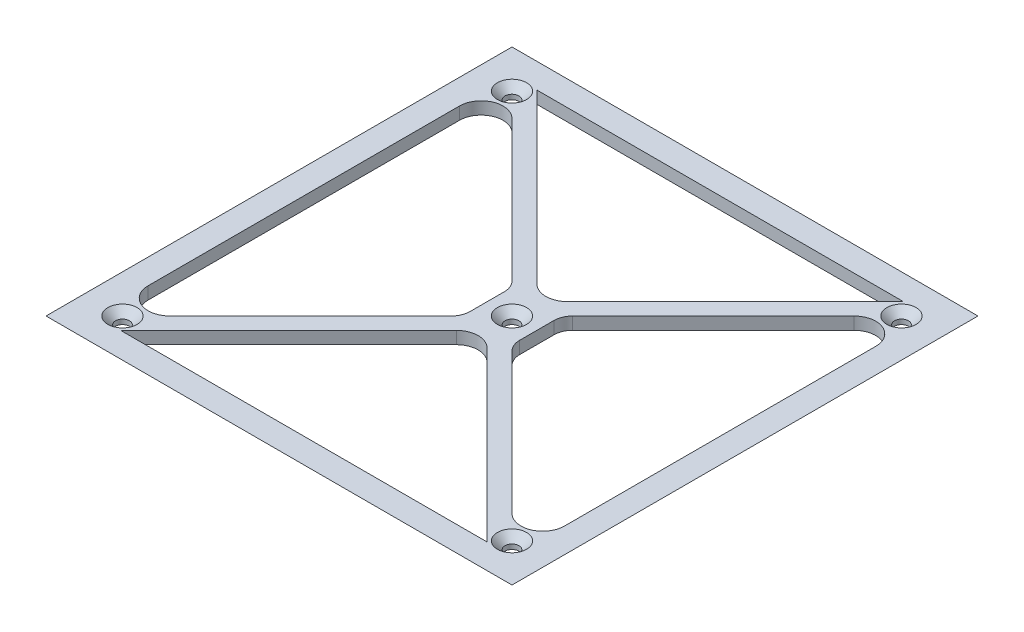
from build123d import *

# Parameters (mm, degrees)
SKETCH1_W                                      = 150
SKETCH1_H                                      = 150
BOSS_EXTRUDE2_DEPTH                            = 4
CSK_FOR_M4_FLAT_HEAD_MACHINE_SCREW1_AT_2_COUNT = 2
CSK_FOR_M4_FLAT_HEAD_MACHINE_SCREW1_AT_2_PITCH = 88.653975713
CSK_FOR_M4_FLAT_HEAD_MACHINE_SCREW1_AT_3_COUNT = 2
CSK_FOR_M4_FLAT_HEAD_MACHINE_SCREW1_AT_3_PITCH = 88.653975713
CSK_FOR_M4_FLAT_HEAD_MACHINE_SCREW1_AT_4_COUNT = 2
CSK_FOR_M4_FLAT_HEAD_MACHINE_SCREW1_AT_4_PITCH = 88.653975713
CSK_FOR_M4_FLAT_HEAD_MACHINE_SCREW1_AT_5_COUNT = 2
CSK_FOR_M4_FLAT_HEAD_MACHINE_SCREW1_AT_5_PITCH = 88.653975713
CHAMFER2_SIZE                                  = 4


with BuildPart() as part:
    # Sketch1 → Boss-Extrude2 (new body)
    with BuildSketch(Plane(origin=(0, 0, 0), x_dir=(1, 0, 0), z_dir=(0, 1, 0))):
        Rectangle(SKETCH1_W, SKETCH1_H)
        with BuildLine():
            Line((-59, 67), (59, 67))
            Line((59, 67), (4.949747468, 12.949747468))
            ThreePointArc((4.949747468, 12.949747468), (0, 10.899494937), (-4.949747468, 12.949747468))
            Line((-4.949747468, 12.949747468), (-59, 67))
        make_face(mode=Mode.SUBTRACT)
        with BuildLine():
            Line((59, -67), (-59, -67))
            Line((-59, -67), (-4.949747468, -12.949747468))
            ThreePointArc((-4.949747468, -12.949747468), (0, -10.899494937), (4.949747468, -12.949747468))
            Line((4.949747468, -12.949747468), (59, -67))
        make_face(mode=Mode.SUBTRACT)
        with BuildLine():
            Line((-67, -50.100505063), (-67, 50.100505063))
            ThreePointArc((-67, 50.100505063), (-62.678784027, 56.567661791), (-55.050252532, 55.050252532))
            Line((-55.050252532, 55.050252532), (-9.757359313, 9.757359313))
            ThreePointArc((-9.757359313, 9.757359313), (-8.456722805, 7.81081922), (-8, 5.514718626))
            Line((-8, 5.514718626), (-8, -5.514718626))
            ThreePointArc((-8, -5.514718626), (-8.456722805, -7.81081922), (-9.757359313, -9.757359313))
            Line((-9.757359313, -9.757359313), (-55.050252532, -55.050252532))
            ThreePointArc((-55.050252532, -55.050252532), (-62.678784027, -56.567661791), (-67, -50.100505063))
        make_face(mode=Mode.SUBTRACT)
        with BuildLine():
            ThreePointArc((67, -50.100505063), (62.678784027, -56.567661791), (55.050252532, -55.050252532))
            Line((55.050252532, -55.050252532), (9.757359313, -9.757359313))
            ThreePointArc((9.757359313, -9.757359313), (8.456722805, -7.81081922), (8, -5.514718626))
            Line((8, -5.514718626), (8, 5.514718626))
            ThreePointArc((8, 5.514718626), (8.456722805, 7.81081922), (9.757359313, 9.757359313))
            Line((9.757359313, 9.757359313), (55.050252532, 55.050252532))
            ThreePointArc((55.050252532, 55.050252532), (62.678784027, 56.567661791), (67, 50.100505063))
            Line((67, 50.100505063), (67, -50.100505063))
        make_face(mode=Mode.SUBTRACT)
    extrude(amount=BOSS_EXTRUDE2_DEPTH)

    # Sketch5 → CSK for M4 Flat Head Machine Screw1 (revolve, cut)
    with BuildSketch(Plane(origin=(0, 4, 0), x_dir=(0, 0, 1), z_dir=(1, 0, 0))):
        Polygon((0, 0), (0, 4), (2.25, 4), (2.25, 2.45), (4.7, 0), align=None)
    csk_for_m4_flat_head_machine_screw1 = revolve(axis=Axis((0, 10.35, 0), (0, -1, 0)), mode=Mode.SUBTRACT)

    # CSK for M4 Flat Head Machine Screw1 at 2: CSK for M4 Flat Head Machine Screw1 ×2
    with Locations(*[Vector(-0.7071067811865477, 0, -0.7071067811865474) * (i * CSK_FOR_M4_FLAT_HEAD_MACHINE_SCREW1_AT_2_PITCH) for i in range(1, CSK_FOR_M4_FLAT_HEAD_MACHINE_SCREW1_AT_2_COUNT)]):
        add(csk_for_m4_flat_head_machine_screw1, mode=Mode.SUBTRACT)

    # CSK for M4 Flat Head Machine Screw1 at 3: CSK for M4 Flat Head Machine Screw1 ×2
    with Locations(*[Vector(0.7071067811865477, 0, -0.7071067811865474) * (i * CSK_FOR_M4_FLAT_HEAD_MACHINE_SCREW1_AT_3_PITCH) for i in range(1, CSK_FOR_M4_FLAT_HEAD_MACHINE_SCREW1_AT_3_COUNT)]):
        add(csk_for_m4_flat_head_machine_screw1, mode=Mode.SUBTRACT)

    # CSK for M4 Flat Head Machine Screw1 at 4: CSK for M4 Flat Head Machine Screw1 ×2
    with Locations(*[Vector(0.7071067811865477, 0, 0.7071067811865474) * (i * CSK_FOR_M4_FLAT_HEAD_MACHINE_SCREW1_AT_4_PITCH) for i in range(1, CSK_FOR_M4_FLAT_HEAD_MACHINE_SCREW1_AT_4_COUNT)]):
        add(csk_for_m4_flat_head_machine_screw1, mode=Mode.SUBTRACT)

    # CSK for M4 Flat Head Machine Screw1 at 5: CSK for M4 Flat Head Machine Screw1 ×2
    with Locations(*[Vector(-0.7071067811865477, 0, 0.7071067811865474) * (i * CSK_FOR_M4_FLAT_HEAD_MACHINE_SCREW1_AT_5_PITCH) for i in range(1, CSK_FOR_M4_FLAT_HEAD_MACHINE_SCREW1_AT_5_COUNT)]):
        add(csk_for_m4_flat_head_machine_screw1, mode=Mode.SUBTRACT)

    # Chamfer2
    chamfer2_edges = [part.edges().sort_by_distance(p)[0] for p in [
        (0, 0, 75),
        (-75, 0, 0),
        (0, 0, -75),
        (75, 0, 0),
    ]]
    chamfer(chamfer2_edges, length=CHAMFER2_SIZE - 0.0001)  # a hair under: the kernel refuses the full size


solid = part.part
